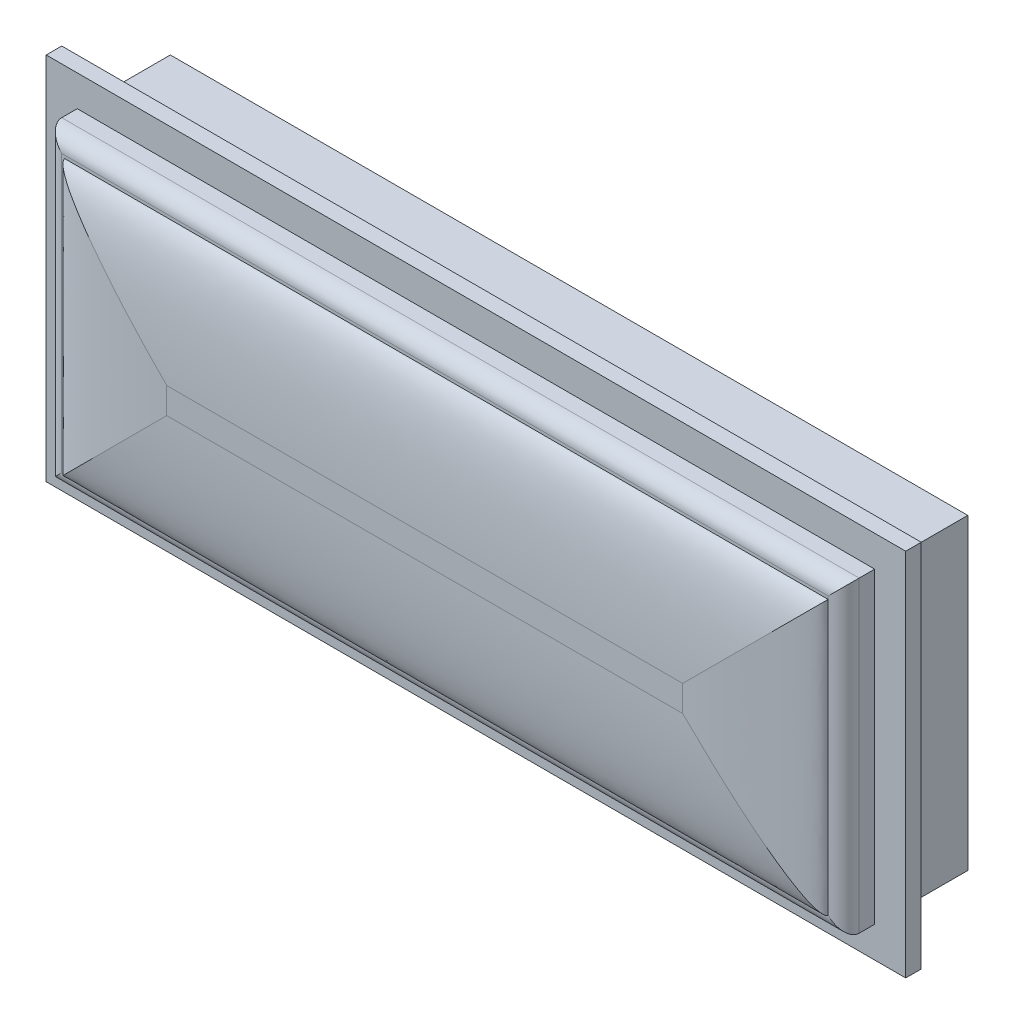
from build123d import *

# Parameters (mm, degrees)
SKETCH1_W              = 256.98477984198917
SKETCH1_H              = 99.11775839010313
BOSS_EXTRUDE1_DEPTH    = 40
BOSS_EXTRUDE2_START    = -10
SKETCH2_W              = 276.98477984198917
SKETCH2_H              = 119.1177583901032
SKETCH2_W_2            = 256.98477984198917
SKETCH2_H_2            = 99.11775839010313
BOSS_EXTRUDE2_DEPTH    = 5
SKETCH3_W              = 236.98477984198917
SKETCH3_H              = 79.11775839010313
CUT_EXTRUDE1_DEPTH     = 36
CUT_EXTRUDE1_DRAFT     = -12.000000000000002
SKETCH4_R              = 8.070775782313257
BOSS_EXTRUDE3_DEPTH    = 15.999999999999973
BOSS_EXTRUDE3_TAPER    = 3.000000000000004
FILLET3_R              = 7
LPATTERN4_COUNT        = 11
LPATTERN4_PITCH        = 20
LPATTERN4_COUNT_DIR2   = 3
LPATTERN4_PITCH_DIR2   = 20
FILLET3_OF_LPATTERN4_R = 7
FILLET4_R              = 5
FILLET5_R              = 5
SKETCH5_W              = 246.03370000796417
SKETCH5_H              = 88.16667855607814
BOSS_EXTRUDE4_DEPTH    = 16.999999999999993
FILLET6_START          = -101.147976301
FILLET6_DEPTH          = 88.166678557
FILLET6_START_2        = -267
FILLET6_2_DEPTH        = 248


with BuildPart() as part:
    # Sketch1 → Boss-Extrude1 (new body)
    with BuildSketch(Plane.XY):
        with Locations((-143.83255522331058, -56.589097105502624)):
            Rectangle(SKETCH1_W, SKETCH1_H)
    extrude(amount=-BOSS_EXTRUDE1_DEPTH)

    # Sketch2 → Boss-Extrude2 (add)
    with BuildSketch(Plane.XY.offset(BOSS_EXTRUDE2_START)):
        with Locations((-143.83255522331058, -56.58909710550259)):
            Rectangle(SKETCH2_W, SKETCH2_H)
        with Locations((-143.83255522331058, -56.589097105502624)):
            Rectangle(SKETCH2_W_2, SKETCH2_H_2, mode=Mode.SUBTRACT)
    extrude(amount=-BOSS_EXTRUDE2_DEPTH)


with BuildPart() as cut_extrude1_tool:
    # Sketch3 → Cut-Extrude1 (with draft: the straight prism first)
    with BuildSketch(Plane.XY):
        with Locations((-143.83255522331058, -56.589097105502624)):
            Rectangle(SKETCH3_W, SKETCH3_H)
    extrude(amount=-CUT_EXTRUDE1_DEPTH)
    # Cut-Extrude1: the draft: its side faces are tilted about the plane it starts from
    cut_extrude1_sides = [cut_extrude1_tool.faces().sort_by_distance(p)[0] for p in [
        (-25.340165302, -56.589097106, -18),
        (-143.832555223, -17.03021791, -18),
        (-262.324945144, -56.589097106, -18),
        (-143.832555223, -96.147976301, -18),
    ]]
    draft(cut_extrude1_sides, Plane.XY, CUT_EXTRUDE1_DRAFT)


with BuildPart() as part_1:
    add(part.part)

    # Cut-Extrude1: cut by cut_extrude1_tool
    add(cut_extrude1_tool.part, mode=Mode.SUBTRACT)


with BuildPart() as body_2:
    # Sketch4 → Boss-Extrude3 (new body)
    with BuildSketch(Plane.XY.offset(-36)):
        with Locations((-243.93309785575923, -37.2414686292899)):
            Circle(SKETCH4_R)
    boss_extrude3 = extrude(amount=BOSS_EXTRUDE3_DEPTH, taper=BOSS_EXTRUDE3_TAPER)

    # Fillet3
    fillet3_edges = [body_2.edges().sort_by_distance(p)[0] for p in [
        (-251.16534916954384, -37.24146862928991, -20.00000000000003),
    ]]
    fillet(fillet3_edges, radius=FILLET3_R)


with BuildPart() as part_2:
    add(part_1.part)

    # LPattern4: Boss-Extrude3 11 × 3
    with Locations(*[(i * LPATTERN4_PITCH, -j * LPATTERN4_PITCH_DIR2, 0) for i in range(LPATTERN4_COUNT) for j in range(LPATTERN4_COUNT_DIR2) if (i, j) != (0, 0)]):
        add(boss_extrude3)

    # Fillet3 of LPattern4
    fillet3_of_lpattern4_edges = [part_2.edges().sort_by_distance(p)[0] for p in [
        (-251.16534916954384, -57.24146862928991, -20.00000000000003),
        (-251.16534916954384, -77.24146862928991, -20.00000000000003),
        (-231.16534916954384, -37.24146862928991, -20.00000000000003),
        (-231.16534916954384, -57.24146862928991, -20.00000000000003),
        (-231.16534916954384, -77.24146862928991, -20.00000000000003),
        (-211.16534916954384, -37.24146862928991, -20.00000000000003),
        (-211.16534916954384, -57.24146862928991, -20.00000000000003),
        (-211.16534916954384, -77.24146862928991, -20.00000000000003),
        (-191.16534916954384, -37.24146862928991, -20.00000000000003),
        (-191.16534916954384, -57.24146862928991, -20.00000000000003),
        (-191.16534916954384, -77.24146862928991, -20.00000000000003),
        (-171.16534916954384, -37.24146862928991, -20.00000000000003),
        (-171.16534916954384, -57.24146862928991, -20.00000000000003),
        (-171.16534916954384, -77.24146862928991, -20.00000000000003),
        (-151.16534916954384, -37.24146862928991, -20.00000000000003),
        (-151.16534916954384, -57.24146862928991, -20.00000000000003),
        (-151.16534916954384, -77.24146862928991, -20.00000000000003),
        (-131.16534916954384, -37.24146862928991, -20.00000000000003),
        (-131.16534916954384, -57.24146862928991, -20.00000000000003),
        (-131.16534916954384, -77.24146862928991, -20.00000000000003),
        (-111.16534916954384, -37.24146862928991, -20.00000000000003),
        (-111.16534916954384, -57.24146862928991, -20.00000000000003),
        (-111.16534916954384, -77.24146862928991, -20.00000000000003),
        (-91.16534916954384, -37.24146862928991, -20.00000000000003),
        (-91.16534916954384, -57.24146862928991, -20.00000000000003),
        (-91.16534916954384, -77.24146862928991, -20.00000000000003),
        (-71.16534916954384, -37.24146862928991, -20.00000000000003),
        (-71.16534916954384, -57.24146862928991, -20.00000000000003),
        (-71.16534916954384, -77.24146862928991, -20.00000000000003),
        (-51.165349169543845, -37.24146862928991, -20.00000000000003),
        (-51.165349169543845, -57.24146862928991, -20.00000000000003),
        (-51.165349169543845, -77.24146862928991, -20.00000000000003),
    ]]
    fillet(fillet3_of_lpattern4_edges, radius=FILLET3_OF_LPATTERN4_R)

    # Fillet4
    # the kernel refuses this fillet: 5 mm, written as the material it adds along each edge
    with BuildSketch(Plane(origin=(-32.9922015224368, -98.61824049537097, -36), x_dir=(-1, 0, 0), z_dir=(0, 1, 0))) as fillet4_piece_1:
        with BuildLine():
            CenterArc((FILLET4_R * 0.809784033195, FILLET4_R), FILLET4_R, 192.00000000000003, 78)
            Line((-FILLET4_R * 0.168363567539, FILLET4_R * 0.792088309182), (0, 0))
            Line((0, 0), (FILLET4_R * 0.809784033195, 0))
        make_face()
    extrude(amount=84.05828677973668)
    with BuildSketch(Plane(origin=(-264.7952093391219, -88.49594008043337, -36), x_dir=(0, 1, 0), z_dir=(1, 0, 0))) as fillet4_piece_2:
        with BuildLine():
            CenterArc((FILLET4_R * 0.809784033195, FILLET4_R), FILLET4_R, 192.00000000000003, 78)
            Line((-FILLET4_R * 0.168363567539, FILLET4_R * 0.792088309182), (0, 0))
            Line((0, 0), (FILLET4_R * 0.809784033195, 0))
        make_face()
    extrude(amount=241.92530823162267)
    with BuildSketch(Plane(origin=(-254.67290892418436, -14.55995371563425, -36), x_dir=(1, 0, 0), z_dir=(0, -1, 0))) as fillet4_piece_3:
        with BuildLine():
            CenterArc((FILLET4_R * 0.809784033195, FILLET4_R), FILLET4_R, 191.99999999999997, 78)
            Line((-FILLET4_R * 0.168363567539, FILLET4_R * 0.792088309182), (0, 0))
            Line((0, 0), (FILLET4_R * 0.809784033195, 0))
        make_face()
    extrude(amount=84.05828677973669)
    with BuildSketch(Plane(origin=(-22.86990110749919, -24.682254130571852, -36), x_dir=(0, -1, 0), z_dir=(-1, 0, 0))) as fillet4_piece_4:
        with BuildLine():
            CenterArc((FILLET4_R * 0.809784033195, FILLET4_R), FILLET4_R, 191.99999999999994, 78.00000000000006)
            Line((-FILLET4_R * 0.168363567539, FILLET4_R * 0.792088309182), (0, 0))
            Line((0, 0), (FILLET4_R * 0.809784033195, 0))
        make_face()
    extrude(amount=241.92530823162275)

    # Fillet5
    fillet5_edges = [part_2.edges().sort_by_distance(p)[0] for p in [
        (-25.340165302315995, -56.589097105502624, 0),
        (-143.83255522331055, -17.030217910451057, 0),
        (-262.32494514430516, -56.58909710550261, 0),
        (-143.83255522331058, -96.14797630055418, 0),
        (-143.83255522331058, -7.030217910451054, 0),
        (-15.340165302315995, -56.58909710550262, 0),
        (-143.83255522331058, -106.14797630055418, 0),
        (-272.32494514430516, -56.58909710550262, 0),
    ]]
    fillet(fillet5_edges, radius=FILLET5_R)

    # Sketch5 → Boss-Extrude4 (add)
    with BuildSketch(Plane.XY.offset(-10)):
        with Locations((-143.35701530629808, -57.06463702251509)):
            Rectangle(SKETCH5_W, SKETCH5_H)
    extrude(amount=BOSS_EXTRUDE4_DEPTH)

    # Fillet6: read off the stored shape, not the designer's step
    # Fillet6 outline → Fillet6 (cut)
    with BuildSketch(Plane(origin=(0, 0, 0), x_dir=(1, 0, 0), z_dir=(0, 1, 0)).offset(FILLET6_START)):
        with BuildLine():
            add(Edge.make_bspline(
                [(-20.340165302, 0), (-20.8666481234081, -6.99999999999999), (-60.227506653, -7)],
                knots=[0, 0, 0, 1, 1, 1], degree=2, weights=[1, 0.733143914930759, 1]))
            Line((-60.227506653, -7), (-20.340165302, -7))
            Line((-20.340165302, -7), (-20.340165302, 0))
        make_face()
        with BuildLine():
            add(Edge.make_bspline(
                [(-266.37386531, 0), (-265.847382489188, -6.999999999999082), (-226.48652396, -7)],
                knots=[0, 0, 0, 1, 1, 1], degree=2, weights=[1, 0.733143914930759, 1]))
            Line((-266.37386531, 0), (-266.37386531, -7))
            Line((-266.37386531, -7), (-226.48652396, -7))
        make_face()
    extrude(amount=FILLET6_DEPTH, mode=Mode.SUBTRACT)

    # Fillet6 2 outline → Fillet6 2 (cut)
    with BuildSketch(Plane.YZ.offset(FILLET6_START_2)):
        with BuildLine():
            Line((-101.147976301, 7), (-101.147976301, 0))
            add(Edge.make_bspline(
                [(-101.147976301, 0), (-100.62149347946199, 6.99999999999999), (-61.26063495, 7)],
                knots=[0, 0, 0, 1, 1, 1], degree=2, weights=[1, 0.733143914930759, 1]))
            Line((-61.26063495, 7), (-101.147976301, 7))
        make_face()
        with BuildLine():
            Line((-12.981297744, 7), (-52.868639095, 7))
            add(Edge.make_bspline(
                [(-12.981297744, 0), (-13.5077805655681, 6.99999999999999), (-52.868639095, 7)],
                knots=[0, 0, 0, 1, 1, 1], degree=2, weights=[1, 0.733143914930759, 1]))
            Line((-12.981297744, 0), (-12.981297744, 7))
        make_face()
    extrude(amount=FILLET6_2_DEPTH, mode=Mode.SUBTRACT)


solid = Compound([body_2.part, part_2.part])
